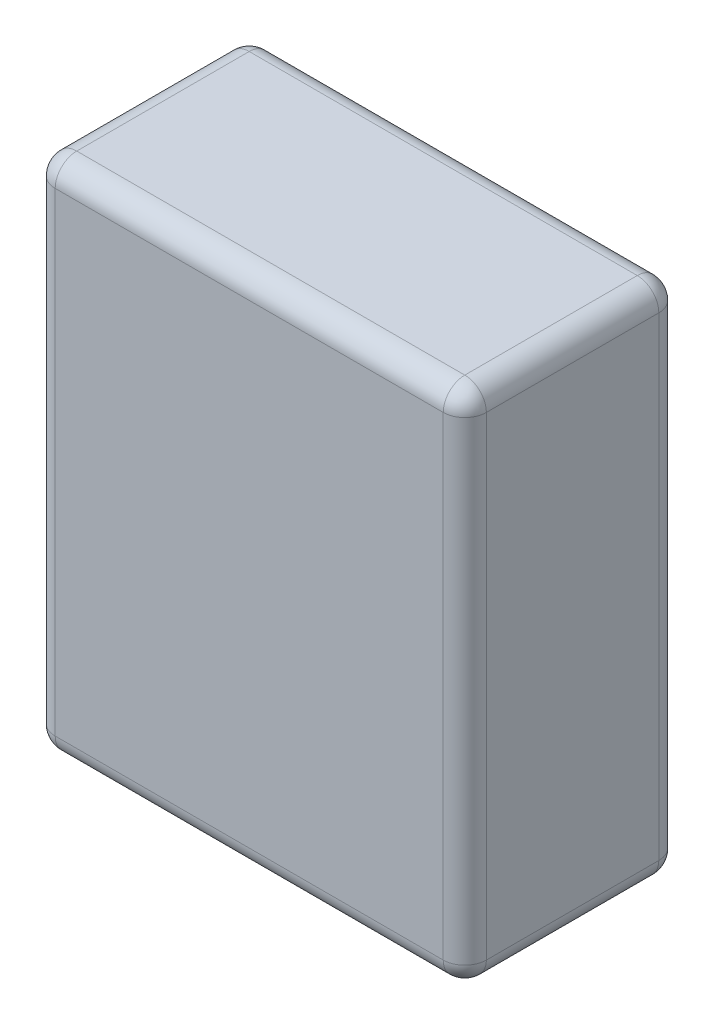
from build123d import *

# Parameters (mm, degrees)
SKETCH_1_W      = 10
SKETCH_1_H      = 12
EXTRUDE_1_DEPTH = 5
FILLET_1_R      = 0.5


with BuildPart() as part:
    # ｽｹｯﾁ1 → ﾎﾞｽ - 押し出し1 (new body)
    with BuildSketch(Plane.XY):
        Rectangle(SKETCH_1_W, SKETCH_1_H)
    extrude(amount=EXTRUDE_1_DEPTH)

    # ﾌｨﾚｯﾄ1
    fillet_1_edges = [part.edges().sort_by_distance(p)[0] for p in [
        (-5, -6, 2.5),
        (-5, 0, 0),
        (0, -6, 0),
        (5, -6, 2.5),
        (5, 0, 0),
        (0, -6, 5),
        (-5, 0, 5),
        (5, 0, 5),
        (5, 6, 2.5),
        (0, 6, 5),
        (-5, 6, 2.5),
        (0, 6, 0),
    ]]
    fillet(fillet_1_edges, radius=FILLET_1_R)


solid = part.part
